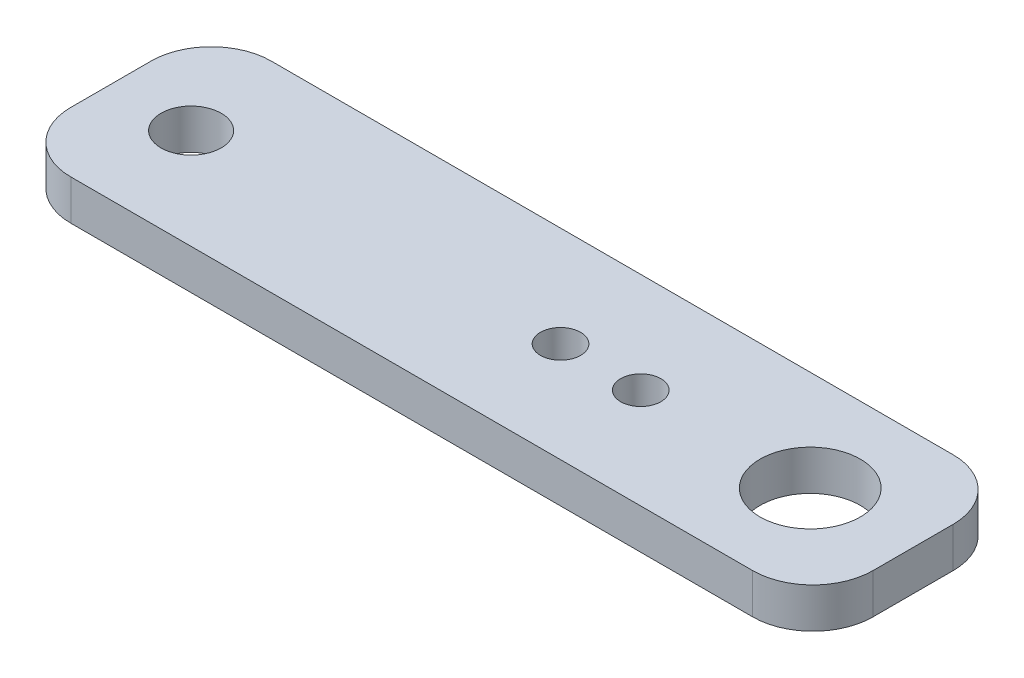
from build123d import *

# Parameters (mm, degrees)
SKETCH1_W             = 40
SKETCH1_H             = 10
BOSS_EXTRUDE1_DEPTH   = 2
F_5_0MM_DOWEL_HOLE1_D = 5
F_3_0MM_DOWEL_HOLE1_D = 3
SKETCH2_R             = 1
CUT_EXTRUDE1_DEPTH    = 3
FILLET1_R             = 3


with BuildPart() as part:
    # Sketch1 → Boss-Extrude1 (new body)
    with BuildSketch(Plane(origin=(0, 0, 0), x_dir=(1, 0, 0), z_dir=(0, 1, 0))):
        Rectangle(SKETCH1_W, SKETCH1_H)
    extrude(amount=BOSS_EXTRUDE1_DEPTH)

    # Ø5.0mm Dowel Hole1 (through all)
    with Locations(Plane(origin=(0, 2, 0), x_dir=(1, 0, 0), z_dir=(0, 1, 0))):
        with Locations((14.8695436, 0)):
            Hole(F_5_0MM_DOWEL_HOLE1_D / 2)

    # Ø3.0mm Dowel Hole1 (through all)
    with Locations(Plane(origin=(0, 2, 0), x_dir=(1, 0, 0), z_dir=(0, 1, 0))):
        with Locations((-16, 0)):
            Hole(F_3_0MM_DOWEL_HOLE1_D / 2)

    # Sketch2 → Cut-Extrude1 (cut)
    with BuildSketch(Plane(origin=(0, 2, 0), x_dir=(1, 0, 0), z_dir=(0, 1, 0))):
        with Locations((6.4195436, 0)):
            Circle(SKETCH2_R)
        with Locations((2.4195436, 0)):
            Circle(SKETCH2_R)
    extrude(amount=-CUT_EXTRUDE1_DEPTH, mode=Mode.SUBTRACT)

    # Fillet1
    fillet1_edges = [part.edges().sort_by_distance(p)[0] for p in [
        (20, 1, 5),
        (20, 1, -5),
        (-20, 1, -5),
        (-20, 1, 5),
    ]]
    fillet(fillet1_edges, radius=FILLET1_R)


solid = part.part
